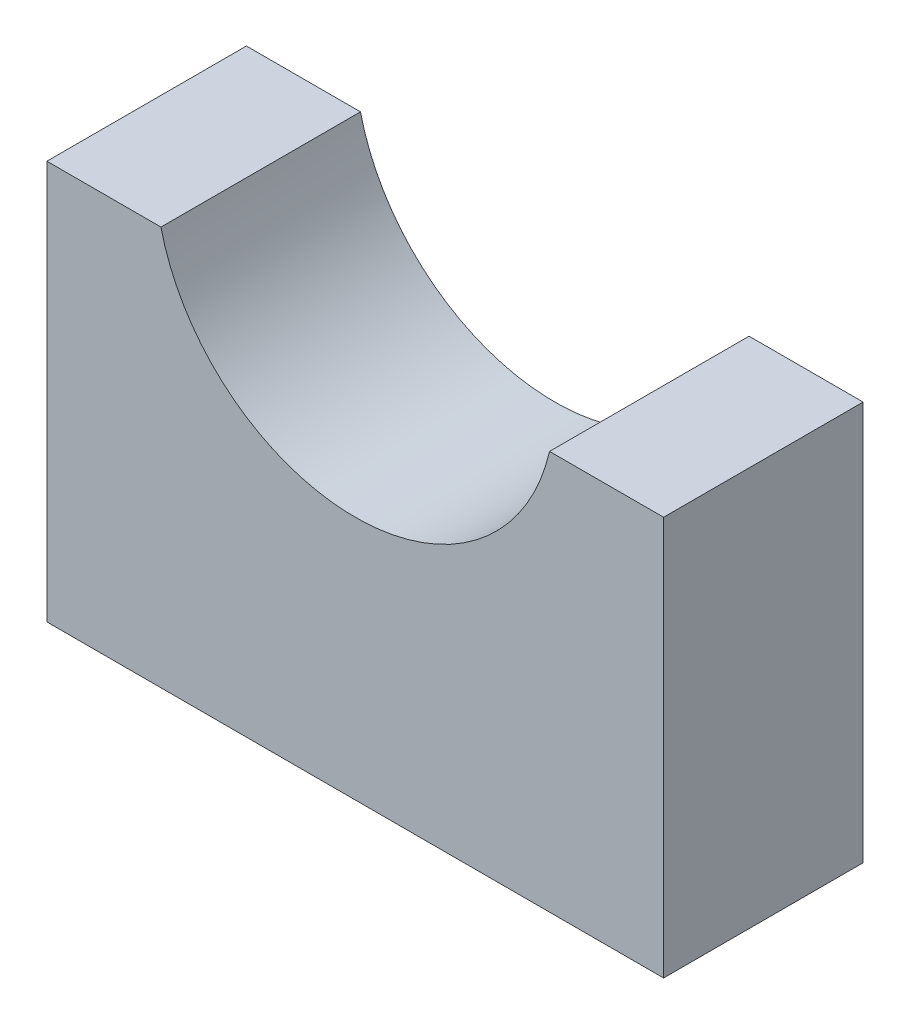
from build123d import *

# Parameters (mm, degrees)
BOSS_EXTRUDE1_DEPTH = 11


with BuildPart() as part:
    # Sketch1 → Boss-Extrude1 (new body)
    with BuildSketch(Plane.XY):
        with BuildLine():
            Line((-10.712142643, -2.5), (-17, -2.5))
            Line((-17, -2.5), (-17, -24.5))
            Line((-17, -24.5), (17, -24.5))
            Line((17, -24.5), (17, -2.5))
            Line((17, -2.5), (10.712142643, -2.5))
            ThreePointArc((10.712142643, -2.5), (0, -11), (-10.712142643, -2.5))
        make_face()
    extrude(amount=BOSS_EXTRUDE1_DEPTH)


solid = part.part
